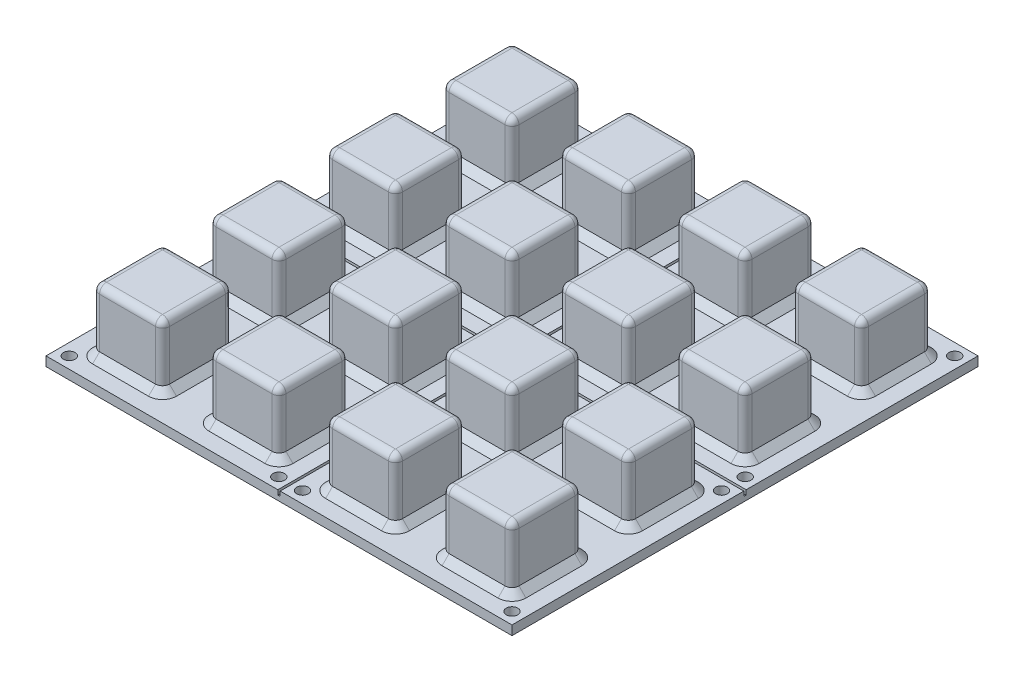
from build123d import *

# Parameters (mm, degrees)
BOSS_EXTRUDE1_DEPTH    = 15.7
BOSS_EXTRUDE1_2_DEPTH  = 15.7
BOSS_EXTRUDE1_3_DEPTH  = 15.7
BOSS_EXTRUDE1_4_DEPTH  = 15.7
BOSS_EXTRUDE1_5_DEPTH  = 15.7
BOSS_EXTRUDE1_6_DEPTH  = 15.7
BOSS_EXTRUDE1_7_DEPTH  = 15.7
BOSS_EXTRUDE1_8_DEPTH  = 15.7
BOSS_EXTRUDE1_9_DEPTH  = 15.7
BOSS_EXTRUDE1_10_DEPTH = 15.7
BOSS_EXTRUDE1_11_DEPTH = 15.7
BOSS_EXTRUDE1_12_DEPTH = 15.7
BOSS_EXTRUDE1_13_DEPTH = 15.7
BOSS_EXTRUDE1_14_DEPTH = 15.7
BOSS_EXTRUDE1_15_DEPTH = 15.7
BOSS_EXTRUDE1_16_DEPTH = 15.7
SKETCH4_W              = 100
SKETCH4_H              = 100
BOSS_EXTRUDE2_DEPTH    = 2
SKETCH5_W              = 0.5
SKETCH5_H              = 100
SKETCH5_W_2            = 100
SKETCH5_H_2            = 0.5
CUT_EXTRUDE1_DEPTH     = 1
SKETCH6_R              = 1.25
CUT_EXTRUDE3_DEPTH     = 3.54
CHAMFER4_SIZE          = 1.5
FILLET2_R              = 1.5
SKETCH7_R              = 4.25
CUT_EXTRUDE4_DEPTH     = 12
FILLET3_R              = 2.5
CUT_EXTRUDE6_DEPTH     = 2.5
SKETCH9_R              = 7
SKETCH9_R_2            = 5
BOSS_EXTRUDE3_DEPTH    = 1
BOSS_EXTRUDE3_2_DEPTH  = 1
BOSS_EXTRUDE3_3_DEPTH  = 1
BOSS_EXTRUDE3_4_DEPTH  = 1
BOSS_EXTRUDE3_5_DEPTH  = 1
BOSS_EXTRUDE3_6_DEPTH  = 1
BOSS_EXTRUDE3_7_DEPTH  = 1
BOSS_EXTRUDE3_8_DEPTH  = 1
BOSS_EXTRUDE3_9_DEPTH  = 1
BOSS_EXTRUDE3_10_DEPTH = 1
BOSS_EXTRUDE3_11_DEPTH = 1
BOSS_EXTRUDE3_12_DEPTH = 1
BOSS_EXTRUDE3_13_DEPTH = 1
BOSS_EXTRUDE3_14_DEPTH = 1
BOSS_EXTRUDE3_15_DEPTH = 1
BOSS_EXTRUDE3_16_DEPTH = 1
SKETCH10_R             = 7
SKETCH10_R_2           = 5
BOSS_EXTRUDE6_DEPTH    = 0.5
BOSS_EXTRUDE6_2_DEPTH  = 0.5
BOSS_EXTRUDE6_3_DEPTH  = 0.5
BOSS_EXTRUDE6_4_DEPTH  = 0.5
BOSS_EXTRUDE6_5_DEPTH  = 0.5
BOSS_EXTRUDE6_6_DEPTH  = 0.5
BOSS_EXTRUDE6_7_DEPTH  = 0.5
BOSS_EXTRUDE6_8_DEPTH  = 0.5
BOSS_EXTRUDE6_9_DEPTH  = 0.5
BOSS_EXTRUDE6_10_DEPTH = 0.5
BOSS_EXTRUDE6_11_DEPTH = 0.5
BOSS_EXTRUDE6_12_DEPTH = 0.5
BOSS_EXTRUDE6_13_DEPTH = 0.5
BOSS_EXTRUDE6_14_DEPTH = 0.5
BOSS_EXTRUDE6_15_DEPTH = 0.5
BOSS_EXTRUDE6_16_DEPTH = 0.5
SKETCH11_R             = 1.25
BOSS_EXTRUDE7_DEPTH    = 1.5
CHAMFER6_SIZE          = 0.25


with BuildPart() as part:
    # Sketch1 → Boss-Extrude1 (new body)
    with BuildSketch(Plane(origin=(0, 0, 0), x_dir=(1, 0, 0), z_dir=(0, 1, 0))):
        with BuildLine():
            Line((-18.5, -30), (-6.5, -30))
            ThreePointArc((-6.5, -30), (-5.439339828, -30.439339828), (-5, -31.5))
            Line((-5, -31.5), (-5, -43.5))
            ThreePointArc((-5, -43.5), (-5.439339828, -44.560660172), (-6.5, -45))
            Line((-6.5, -45), (-18.5, -45))
            ThreePointArc((-18.5, -45), (-19.560660172, -44.560660172), (-20, -43.5))
            Line((-20, -43.5), (-20, -31.5))
            ThreePointArc((-20, -31.5), (-19.560660172, -30.439339828), (-18.5, -30))
        make_face()
    extrude(amount=BOSS_EXTRUDE1_DEPTH)



with BuildPart() as body_2:
    # Sketch1 → Boss-Extrude1 2 (new body)
    with BuildSketch(Plane(origin=(0, 0, 0), x_dir=(1, 0, 0), z_dir=(0, 1, 0))):
        with BuildLine():
            Line((6.5, -30), (18.5, -30))
            ThreePointArc((18.5, -30), (19.560660172, -30.439339828), (20, -31.5))
            Line((20, -31.5), (20, -43.5))
            ThreePointArc((20, -43.5), (19.560660172, -44.560660172), (18.5, -45))
            Line((18.5, -45), (6.5, -45))
            ThreePointArc((6.5, -45), (5.439339828, -44.560660172), (5, -43.5))
            Line((5, -43.5), (5, -31.5))
            ThreePointArc((5, -31.5), (5.439339828, -30.439339828), (6.5, -30))
        make_face()
    extrude(amount=BOSS_EXTRUDE1_2_DEPTH)


with BuildPart() as body_3:
    # Sketch1 → Boss-Extrude1 3 (new body)
    with BuildSketch(Plane(origin=(0, 0, 0), x_dir=(1, 0, 0), z_dir=(0, 1, 0))):
        with BuildLine():
            Line((-43.5, -30), (-31.5, -30))
            ThreePointArc((-31.5, -30), (-30.439339828, -30.439339828), (-30, -31.5))
            Line((-30, -31.5), (-30, -43.5))
            ThreePointArc((-30, -43.5), (-30.439339828, -44.560660172), (-31.5, -45))
            Line((-31.5, -45), (-43.5, -45))
            ThreePointArc((-43.5, -45), (-44.560660172, -44.560660172), (-45, -43.5))
            Line((-45, -43.5), (-45, -31.5))
            ThreePointArc((-45, -31.5), (-44.560660172, -30.439339828), (-43.5, -30))
        make_face()
    extrude(amount=BOSS_EXTRUDE1_3_DEPTH)


with BuildPart() as body_4:
    # Sketch1 → Boss-Extrude1 4 (new body)
    with BuildSketch(Plane(origin=(0, 0, 0), x_dir=(1, 0, 0), z_dir=(0, 1, 0))):
        with BuildLine():
            Line((31.5, -30), (43.5, -30))
            ThreePointArc((43.5, -30), (44.560660172, -30.439339828), (45, -31.5))
            Line((45, -31.5), (45, -43.5))
            ThreePointArc((45, -43.5), (44.560660172, -44.560660172), (43.5, -45))
            Line((43.5, -45), (31.5, -45))
            ThreePointArc((31.5, -45), (30.439339828, -44.560660172), (30, -43.5))
            Line((30, -43.5), (30, -31.5))
            ThreePointArc((30, -31.5), (30.439339828, -30.439339828), (31.5, -30))
        make_face()
    extrude(amount=BOSS_EXTRUDE1_4_DEPTH)


with BuildPart() as body_5:
    # Sketch1 → Boss-Extrude1 5 (new body)
    with BuildSketch(Plane(origin=(0, 0, 0), x_dir=(1, 0, 0), z_dir=(0, 1, 0))):
        with BuildLine():
            Line((-18.5, -5), (-6.5, -5))
            ThreePointArc((-6.5, -5), (-5.439339828, -5.439339828), (-5, -6.5))
            Line((-5, -6.5), (-5, -18.5))
            ThreePointArc((-5, -18.5), (-5.439339828, -19.560660172), (-6.5, -20))
            Line((-6.5, -20), (-18.5, -20))
            ThreePointArc((-18.5, -20), (-19.560660172, -19.560660172), (-20, -18.5))
            Line((-20, -18.5), (-20, -6.5))
            ThreePointArc((-20, -6.5), (-19.560660172, -5.439339828), (-18.5, -5))
        make_face()
    extrude(amount=BOSS_EXTRUDE1_5_DEPTH)


with BuildPart() as body_6:
    # Sketch1 → Boss-Extrude1 6 (new body)
    with BuildSketch(Plane(origin=(0, 0, 0), x_dir=(1, 0, 0), z_dir=(0, 1, 0))):
        with BuildLine():
            Line((6.5, -5), (18.5, -5))
            ThreePointArc((18.5, -5), (19.560660172, -5.439339828), (20, -6.5))
            Line((20, -6.5), (20, -18.5))
            ThreePointArc((20, -18.5), (19.560660172, -19.560660172), (18.5, -20))
            Line((18.5, -20), (6.5, -20))
            ThreePointArc((6.5, -20), (5.439339828, -19.560660172), (5, -18.5))
            Line((5, -18.5), (5, -6.5))
            ThreePointArc((5, -6.5), (5.439339828, -5.439339828), (6.5, -5))
        make_face()
    extrude(amount=BOSS_EXTRUDE1_6_DEPTH)


with BuildPart() as body_7:
    # Sketch1 → Boss-Extrude1 7 (new body)
    with BuildSketch(Plane(origin=(0, 0, 0), x_dir=(1, 0, 0), z_dir=(0, 1, 0))):
        with BuildLine():
            Line((31.5, -5), (43.5, -5))
            ThreePointArc((43.5, -5), (44.560660172, -5.439339828), (45, -6.5))
            Line((45, -6.5), (45, -18.5))
            ThreePointArc((45, -18.5), (44.560660172, -19.560660172), (43.5, -20))
            Line((43.5, -20), (31.5, -20))
            ThreePointArc((31.5, -20), (30.439339828, -19.560660172), (30, -18.5))
            Line((30, -18.5), (30, -6.5))
            ThreePointArc((30, -6.5), (30.439339828, -5.439339828), (31.5, -5))
        make_face()
    extrude(amount=BOSS_EXTRUDE1_7_DEPTH)


with BuildPart() as body_8:
    # Sketch1 → Boss-Extrude1 8 (new body)
    with BuildSketch(Plane(origin=(0, 0, 0), x_dir=(1, 0, 0), z_dir=(0, 1, 0))):
        with BuildLine():
            Line((-18.5, 20), (-6.5, 20))
            ThreePointArc((-6.5, 20), (-5.439339828, 19.560660172), (-5, 18.5))
            Line((-5, 18.5), (-5, 6.5))
            ThreePointArc((-5, 6.5), (-5.439339828, 5.439339828), (-6.5, 5))
            Line((-6.5, 5), (-18.5, 5))
            ThreePointArc((-18.5, 5), (-19.560660172, 5.439339828), (-20, 6.5))
            Line((-20, 6.5), (-20, 18.5))
            ThreePointArc((-20, 18.5), (-19.560660172, 19.560660172), (-18.5, 20))
        make_face()
    extrude(amount=BOSS_EXTRUDE1_8_DEPTH)


with BuildPart() as body_9:
    # Sketch1 → Boss-Extrude1 9 (new body)
    with BuildSketch(Plane(origin=(0, 0, 0), x_dir=(1, 0, 0), z_dir=(0, 1, 0))):
        with BuildLine():
            Line((6.5, 20), (18.5, 20))
            ThreePointArc((18.5, 20), (19.560660172, 19.560660172), (20, 18.5))
            Line((20, 18.5), (20, 6.5))
            ThreePointArc((20, 6.5), (19.560660172, 5.439339828), (18.5, 5))
            Line((18.5, 5), (6.5, 5))
            ThreePointArc((6.5, 5), (5.439339828, 5.439339828), (5, 6.5))
            Line((5, 6.5), (5, 18.5))
            ThreePointArc((5, 18.5), (5.439339828, 19.560660172), (6.5, 20))
        make_face()
    extrude(amount=BOSS_EXTRUDE1_9_DEPTH)


with BuildPart() as body_10:
    # Sketch1 → Boss-Extrude1 10 (new body)
    with BuildSketch(Plane(origin=(0, 0, 0), x_dir=(1, 0, 0), z_dir=(0, 1, 0))):
        with BuildLine():
            Line((31.5, 20), (43.5, 20))
            ThreePointArc((43.5, 20), (44.560660172, 19.560660172), (45, 18.5))
            Line((45, 18.5), (45, 6.5))
            ThreePointArc((45, 6.5), (44.560660172, 5.439339828), (43.5, 5))
            Line((43.5, 5), (31.5, 5))
            ThreePointArc((31.5, 5), (30.439339828, 5.439339828), (30, 6.5))
            Line((30, 6.5), (30, 18.5))
            ThreePointArc((30, 18.5), (30.439339828, 19.560660172), (31.5, 20))
        make_face()
    extrude(amount=BOSS_EXTRUDE1_10_DEPTH)


with BuildPart() as body_11:
    # Sketch1 → Boss-Extrude1 11 (new body)
    with BuildSketch(Plane(origin=(0, 0, 0), x_dir=(1, 0, 0), z_dir=(0, 1, 0))):
        with BuildLine():
            Line((-18.5, 45), (-6.5, 45))
            ThreePointArc((-6.5, 45), (-5.439339828, 44.560660172), (-5, 43.5))
            Line((-5, 43.5), (-5, 31.5))
            ThreePointArc((-5, 31.5), (-5.439339828, 30.439339828), (-6.5, 30))
            Line((-6.5, 30), (-18.5, 30))
            ThreePointArc((-18.5, 30), (-19.560660172, 30.439339828), (-20, 31.5))
            Line((-20, 31.5), (-20, 43.5))
            ThreePointArc((-20, 43.5), (-19.560660172, 44.560660172), (-18.5, 45))
        make_face()
    extrude(amount=BOSS_EXTRUDE1_11_DEPTH)


with BuildPart() as body_12:
    # Sketch1 → Boss-Extrude1 12 (new body)
    with BuildSketch(Plane(origin=(0, 0, 0), x_dir=(1, 0, 0), z_dir=(0, 1, 0))):
        with BuildLine():
            Line((6.5, 45), (18.5, 45))
            ThreePointArc((18.5, 45), (19.560660172, 44.560660172), (20, 43.5))
            Line((20, 43.5), (20, 31.5))
            ThreePointArc((20, 31.5), (19.560660172, 30.439339828), (18.5, 30))
            Line((18.5, 30), (6.5, 30))
            ThreePointArc((6.5, 30), (5.439339828, 30.439339828), (5, 31.5))
            Line((5, 31.5), (5, 43.5))
            ThreePointArc((5, 43.5), (5.439339828, 44.560660172), (6.5, 45))
        make_face()
    extrude(amount=BOSS_EXTRUDE1_12_DEPTH)


with BuildPart() as body_13:
    # Sketch1 → Boss-Extrude1 13 (new body)
    with BuildSketch(Plane(origin=(0, 0, 0), x_dir=(1, 0, 0), z_dir=(0, 1, 0))):
        with BuildLine():
            Line((31.5, 45), (43.5, 45))
            ThreePointArc((43.5, 45), (44.560660172, 44.560660172), (45, 43.5))
            Line((45, 43.5), (45, 31.5))
            ThreePointArc((45, 31.5), (44.560660172, 30.439339828), (43.5, 30))
            Line((43.5, 30), (31.5, 30))
            ThreePointArc((31.5, 30), (30.439339828, 30.439339828), (30, 31.5))
            Line((30, 31.5), (30, 43.5))
            ThreePointArc((30, 43.5), (30.439339828, 44.560660172), (31.5, 45))
        make_face()
    extrude(amount=BOSS_EXTRUDE1_13_DEPTH)


with BuildPart() as body_14:
    # Sketch1 → Boss-Extrude1 14 (new body)
    with BuildSketch(Plane(origin=(0, 0, 0), x_dir=(1, 0, 0), z_dir=(0, 1, 0))):
        with BuildLine():
            Line((-43.5, -5), (-31.5, -5))
            ThreePointArc((-31.5, -5), (-30.439339828, -5.439339828), (-30, -6.5))
            Line((-30, -6.5), (-30, -18.5))
            ThreePointArc((-30, -18.5), (-30.439339828, -19.560660172), (-31.5, -20))
            Line((-31.5, -20), (-43.5, -20))
            ThreePointArc((-43.5, -20), (-44.560660172, -19.560660172), (-45, -18.5))
            Line((-45, -18.5), (-45, -6.5))
            ThreePointArc((-45, -6.5), (-44.560660172, -5.439339828), (-43.5, -5))
        make_face()
    extrude(amount=BOSS_EXTRUDE1_14_DEPTH)


with BuildPart() as body_15:
    # Sketch1 → Boss-Extrude1 15 (new body)
    with BuildSketch(Plane(origin=(0, 0, 0), x_dir=(1, 0, 0), z_dir=(0, 1, 0))):
        with BuildLine():
            Line((-43.5, 20), (-31.5, 20))
            ThreePointArc((-31.5, 20), (-30.439339828, 19.560660172), (-30, 18.5))
            Line((-30, 18.5), (-30, 6.5))
            ThreePointArc((-30, 6.5), (-30.439339828, 5.439339828), (-31.5, 5))
            Line((-31.5, 5), (-43.5, 5))
            ThreePointArc((-43.5, 5), (-44.560660172, 5.439339828), (-45, 6.5))
            Line((-45, 6.5), (-45, 18.5))
            ThreePointArc((-45, 18.5), (-44.560660172, 19.560660172), (-43.5, 20))
        make_face()
    extrude(amount=BOSS_EXTRUDE1_15_DEPTH)


with BuildPart() as body_16:
    # Sketch1 → Boss-Extrude1 16 (new body)
    with BuildSketch(Plane(origin=(0, 0, 0), x_dir=(1, 0, 0), z_dir=(0, 1, 0))):
        with BuildLine():
            Line((-43.5, 45), (-31.5, 45))
            ThreePointArc((-31.5, 45), (-30.439339828, 44.560660172), (-30, 43.5))
            Line((-30, 43.5), (-30, 31.5))
            ThreePointArc((-30, 31.5), (-30.439339828, 30.439339828), (-31.5, 30))
            Line((-31.5, 30), (-43.5, 30))
            ThreePointArc((-43.5, 30), (-44.560660172, 30.439339828), (-45, 31.5))
            Line((-45, 31.5), (-45, 43.5))
            ThreePointArc((-45, 43.5), (-44.560660172, 44.560660172), (-43.5, 45))
        make_face()
    extrude(amount=BOSS_EXTRUDE1_16_DEPTH)


with BuildPart() as part_1:
    add(part.part)

    add(body_2.part)  # Boss-Extrude2 merges body 2

    add(body_3.part)  # Boss-Extrude2 merges body 3

    add(body_4.part)  # Boss-Extrude2 merges body 4

    add(body_5.part)  # Boss-Extrude2 merges body 5

    add(body_6.part)  # Boss-Extrude2 merges body 6

    add(body_7.part)  # Boss-Extrude2 merges body 7

    add(body_8.part)  # Boss-Extrude2 merges body 8

    add(body_9.part)  # Boss-Extrude2 merges body 9

    add(body_10.part)  # Boss-Extrude2 merges body 10

    add(body_11.part)  # Boss-Extrude2 merges body 11

    add(body_12.part)  # Boss-Extrude2 merges body 12

    add(body_13.part)  # Boss-Extrude2 merges body 13

    add(body_14.part)  # Boss-Extrude2 merges body 14

    add(body_15.part)  # Boss-Extrude2 merges body 15

    add(body_16.part)  # Boss-Extrude2 merges body 16
    # Sketch4 → Boss-Extrude2 (add)
    with BuildSketch(Plane(origin=(0, 0, 0), x_dir=(1, 0, 0), z_dir=(0, 1, 0))):
        Rectangle(SKETCH4_W, SKETCH4_H)
    extrude(amount=BOSS_EXTRUDE2_DEPTH)

    # Sketch5 → Cut-Extrude1 (cut)
    with BuildSketch(Plane(origin=(0, 2, 0), x_dir=(1, 0, 0), z_dir=(0, 1, 0))):
        Rectangle(SKETCH5_W, SKETCH5_H)
        Rectangle(SKETCH5_W_2, SKETCH5_H_2)
    extrude(amount=-CUT_EXTRUDE1_DEPTH, mode=Mode.SUBTRACT)

    # Sketch6 → Cut-Extrude3 (cut)
    with BuildSketch(Plane(origin=(0, 0, 0), x_dir=(1, 0, 0), z_dir=(0, 1, 0))):
        with Locations(Location((-47.5, 47.5, 0), (0, 0, 270))):
            Circle(SKETCH6_R)
        with Locations(Location((-2.542, 47.5, 0), (0, 0, 270))):
            Circle(SKETCH6_R)
        with Locations(Location((-2.542, 2.542, 0), (0, 0, 270))):
            Circle(SKETCH6_R)
        with Locations(Location((-47.5, 2.542, 0), (0, 0, 270))):
            Circle(SKETCH6_R)
        with Locations(Location((47.5, 2.542, 0), (0, 0, 90))):
            Circle(SKETCH6_R)
        with Locations(Location((2.542, 2.542, 0), (0, 0, 90))):
            Circle(SKETCH6_R)
        with Locations(Location((2.542, 47.5, 0), (0, 0, 90))):
            Circle(SKETCH6_R)
        with Locations(Location((47.5, 47.5, 0), (0, 0, 90))):
            Circle(SKETCH6_R)
        with Locations(Location((47.5, -47.5, 0), (0, 0, 270))):
            Circle(SKETCH6_R)
        with Locations(Location((2.542, -47.5, 0), (0, 0, 270))):
            Circle(SKETCH6_R)
        with Locations(Location((2.542, -2.542, 0), (0, 0, 270))):
            Circle(SKETCH6_R)
        with Locations(Location((47.5, -2.542, 0), (0, 0, 270))):
            Circle(SKETCH6_R)
        with Locations(Location((-47.5, -2.542, 0), (0, 0, 90))):
            Circle(SKETCH6_R)
        with Locations(Location((-2.542, -2.542, 0), (0, 0, 90))):
            Circle(SKETCH6_R)
        with Locations(Location((-2.542, -47.5, 0), (0, 0, 90))):
            Circle(SKETCH6_R)
        with Locations(Location((-47.5, -47.5, 0), (0, 0, 90))):
            Circle(SKETCH6_R)
    extrude(amount=CUT_EXTRUDE3_DEPTH, mode=Mode.SUBTRACT)

    # Chamfer4
    chamfer4_edges = [part_1.edges().sort_by_distance(p)[0] for p in [
        (44.560660172, 2, 30.439339828),
        (37.5, 2, 30),
        (30.439339828, 2, 30.439339828),
        (30, 2, 37.5),
        (30.439339828, 2, 44.560660172),
        (37.5, 2, 45),
        (44.560660172, 2, 44.560660172),
        (45, 2, 37.5),
        (-5.439339828, 2, 5.439339828),
        (-12.5, 2, 5),
        (-19.560660172, 2, 5.439339828),
        (-20, 2, 12.5),
        (-19.560660172, 2, 19.560660172),
        (-12.5, 2, 20),
        (-5.439339828, 2, 19.560660172),
        (-5, 2, 12.5),
        (19.560660172, 2, 5.439339828),
        (12.5, 2, 5),
        (5.439339828, 2, 5.439339828),
        (5, 2, 12.5),
        (5.439339828, 2, 19.560660172),
        (12.5, 2, 20),
        (19.560660172, 2, 19.560660172),
        (20, 2, 12.5),
        (44.560660172, 2, 5.439339828),
        (37.5, 2, 5),
        (30.439339828, 2, 5.439339828),
        (30, 2, 12.5),
        (30.439339828, 2, 19.560660172),
        (37.5, 2, 20),
        (44.560660172, 2, 19.560660172),
        (45, 2, 12.5),
        (-5.439339828, 2, -19.560660172),
        (-12.5, 2, -20),
        (-19.560660172, 2, -19.560660172),
        (-20, 2, -12.5),
        (-19.560660172, 2, -5.439339828),
        (-12.5, 2, -5),
        (-5.439339828, 2, -5.439339828),
        (-5, 2, -12.5),
        (19.560660172, 2, -19.560660172),
        (12.5, 2, -20),
        (5.439339828, 2, -19.560660172),
        (-30, 2, 37.5),
        (5, 2, -12.5),
        (5.439339828, 2, -5.439339828),
        (12.5, 2, -5),
        (19.560660172, 2, -5.439339828),
        (20, 2, -12.5),
        (44.560660172, 2, -19.560660172),
        (37.5, 2, -20),
        (30.439339828, 2, -19.560660172),
        (30, 2, -12.5),
        (30.439339828, 2, -5.439339828),
        (37.5, 2, -5),
        (44.560660172, 2, -5.439339828),
        (45, 2, -12.5),
        (-5.439339828, 2, -44.560660172),
        (-12.5, 2, -45),
        (-19.560660172, 2, -44.560660172),
        (-20, 2, -37.5),
        (-19.560660172, 2, -30.439339828),
        (-12.5, 2, -30),
        (-5.439339828, 2, -30.439339828),
        (-5, 2, -37.5),
        (19.560660172, 2, -44.560660172),
        (12.5, 2, -45),
        (5.439339828, 2, -44.560660172),
        (5, 2, -37.5),
        (5.439339828, 2, -30.439339828),
        (12.5, 2, -30),
        (19.560660172, 2, -30.439339828),
        (20, 2, -37.5),
        (-30.439339828, 2, 30.439339828),
        (-37.5, 2, 30),
        (-44.560660172, 2, 30.439339828),
        (-45, 2, 37.5),
        (-44.560660172, 2, 44.560660172),
        (-37.5, 2, 45),
        (-30.439339828, 2, 44.560660172),
        (44.560660172, 2, -44.560660172),
        (37.5, 2, -45),
        (30.439339828, 2, -44.560660172),
        (30, 2, -37.5),
        (30.439339828, 2, -30.439339828),
        (37.5, 2, -30),
        (44.560660172, 2, -30.439339828),
        (45, 2, -37.5),
        (-30.439339828, 2, 5.439339828),
        (-37.5, 2, 5),
        (-44.560660172, 2, 5.439339828),
        (-45, 2, 12.5),
        (-44.560660172, 2, 19.560660172),
        (-37.5, 2, 20),
        (-30.439339828, 2, 19.560660172),
        (-30, 2, 12.5),
        (-30.439339828, 2, -19.560660172),
        (-37.5, 2, -20),
        (-44.560660172, 2, -19.560660172),
        (-45, 2, -12.5),
        (-44.560660172, 2, -5.439339828),
        (-37.5, 2, -5),
        (-30.439339828, 2, -5.439339828),
        (-30, 2, -12.5),
        (-30.439339828, 2, -44.560660172),
        (-37.5, 2, -45),
        (-44.560660172, 2, -44.560660172),
        (-45, 2, -37.5),
        (-44.560660172, 2, -30.439339828),
        (-37.5, 2, -30),
        (-30.439339828, 2, -30.439339828),
        (-30, 2, -37.5),
        (-5.439339828, 2, 30.439339828),
        (-12.5, 2, 30),
        (-19.560660172, 2, 30.439339828),
        (-20, 2, 37.5),
        (-19.560660172, 2, 44.560660172),
        (-12.5, 2, 45),
        (-5.439339828, 2, 44.560660172),
        (-5, 2, 37.5),
        (19.560660172, 2, 30.439339828),
        (12.5, 2, 30),
        (5.439339828, 2, 30.439339828),
        (5, 2, 37.5),
        (5.439339828, 2, 44.560660172),
        (12.5, 2, 45),
        (19.560660172, 2, 44.560660172),
        (20, 2, 37.5),
    ]]
    chamfer(chamfer4_edges, length=CHAMFER4_SIZE)

    # Fillet2
    fillet2_edges = [part_1.edges().sort_by_distance(p)[0] for p in [
        (37.5, 15.7, 30),
        (30, 15.7, 37.5),
        (37.5, 15.7, 45),
        (45, 15.7, 37.5),
        (-45, 15.7, 37.5),
        (-12.5, 15.7, 5),
        (-20, 15.7, 12.5),
        (-12.5, 15.7, 20),
        (-5, 15.7, 12.5),
        (12.5, 15.7, 5),
        (5, 15.7, 12.5),
        (12.5, 15.7, 20),
        (20, 15.7, 12.5),
        (37.5, 15.7, 5),
        (30, 15.7, 12.5),
        (37.5, 15.7, 20),
        (45, 15.7, 12.5),
        (-37.5, 15.7, 45),
        (-12.5, 15.7, -20),
        (-20, 15.7, -12.5),
        (-12.5, 15.7, -5),
        (-5, 15.7, -12.5),
        (12.5, 15.7, -20),
        (5, 15.7, -12.5),
        (12.5, 15.7, -5),
        (20, 15.7, -12.5),
        (-30, 15.7, 37.5),
        (37.5, 15.7, -20),
        (30, 15.7, -12.5),
        (37.5, 15.7, -5),
        (45, 15.7, -12.5),
        (-12.5, 15.7, -45),
        (-20, 15.7, -37.5),
        (-12.5, 15.7, -30),
        (-5, 15.7, -37.5),
        (12.5, 15.7, -45),
        (5, 15.7, -37.5),
        (12.5, 15.7, -30),
        (20, 15.7, -37.5),
        (37.5, 15.7, -45),
        (30, 15.7, -37.5),
        (37.5, 15.7, -30),
        (45, 15.7, -37.5),
        (-37.5, 15.7, 5),
        (-45, 15.7, 12.5),
        (-37.5, 15.7, 20),
        (-30, 15.7, 12.5),
        (-37.5, 15.7, -20),
        (-45, 15.7, -12.5),
        (-37.5, 15.7, -5),
        (-30, 15.7, -12.5),
        (-37.5, 15.7, -45),
        (-45, 15.7, -37.5),
        (-37.5, 15.7, -30),
        (-30, 15.7, -37.5),
        (-12.5, 15.7, 30),
        (-20, 15.7, 37.5),
        (-12.5, 15.7, 45),
        (-5, 15.7, 37.5),
        (-37.5, 15.7, 30),
        (12.5, 15.7, 30),
        (5, 15.7, 37.5),
        (12.5, 15.7, 45),
        (20, 15.7, 37.5),
    ]]
    fillet(fillet2_edges, radius=FILLET2_R)

    # Sketch7 → Cut-Extrude4 (cut)
    with BuildSketch(Plane.XZ):
        with Locations(Location((-37.5, 37.5, 0), (0, 0, 270))):
            Circle(SKETCH7_R)
        with Locations(Location((-12.5, 37.5, 0), (0, 0, 270))):
            Circle(SKETCH7_R)
        with Locations(Location((12.5, 37.5, 0), (0, 0, 270))):
            Circle(SKETCH7_R)
        with Locations(Location((37.5, 37.5, 0), (0, 0, 270))):
            Circle(SKETCH7_R)
        with Locations(Location((-12.5, 12.5, 0), (0, 0, 270))):
            Circle(SKETCH7_R)
        with Locations(Location((12.5, 12.5, 0), (0, 0, 270))):
            Circle(SKETCH7_R)
        with Locations(Location((37.5, 12.5, 0), (0, 0, 270))):
            Circle(SKETCH7_R)
        with Locations(Location((-12.5, -12.5, 0), (0, 0, 270))):
            Circle(SKETCH7_R)
        with Locations(Location((12.5, -12.5, 0), (0, 0, 270))):
            Circle(SKETCH7_R)
        with Locations(Location((37.5, -12.5, 0), (0, 0, 270))):
            Circle(SKETCH7_R)
        with Locations(Location((-12.5, -37.5, 0), (0, 0, 270))):
            Circle(SKETCH7_R)
        with Locations(Location((12.5, -37.5, 0), (0, 0, 270))):
            Circle(SKETCH7_R)
        with Locations(Location((37.5, -37.5, 0), (0, 0, 270))):
            Circle(SKETCH7_R)
        with Locations(Location((-37.5, 12.5, 0), (0, 0, 270))):
            Circle(SKETCH7_R)
        with Locations(Location((-37.5, -12.5, 0), (0, 0, 270))):
            Circle(SKETCH7_R)
        with Locations(Location((-37.5, -37.5, 0), (0, 0, 270))):
            Circle(SKETCH7_R)
    extrude(amount=-CUT_EXTRUDE4_DEPTH, mode=Mode.SUBTRACT)

    # Fillet3
    fillet3_edges = [part_1.edges().sort_by_distance(p)[0] for p in [
        (-37.5, 12, 41.75),
        (-12.5, 12, 41.75),
        (12.5, 12, 41.75),
        (37.5, 12, 41.75),
        (-12.5, 12, 16.75),
        (12.5, 12, 16.75),
        (37.5, 12, 16.75),
        (-12.5, 12, -8.25),
        (12.5, 12, -8.25),
        (37.5, 12, -8.25),
        (-12.5, 12, -33.25),
        (12.5, 12, -33.25),
        (37.5, 12, -33.25),
        (-37.5, 12, 16.75),
        (-37.5, 12, -8.25),
        (-37.5, 12, -33.25),
    ]]
    fillet(fillet3_edges, radius=FILLET3_R)

    # Sketch8 → Cut-Extrude6 (cut)
    with BuildSketch(Plane.XZ):
        with BuildLine():
            Line((-18.429516067, 29.5), (-6.570483933, 29.5))
            ThreePointArc((-6.570483933, 29.5), (-5.106430704, 30.106430704), (-4.5, 31.570483933))
            Line((-4.5, 31.570483933), (-4.5, 43.429516067))
            ThreePointArc((-4.5, 43.429516067), (-5.106430704, 44.893569296), (-6.570483933, 45.5))
            Line((-6.570483933, 45.5), (-18.429516067, 45.5))
            ThreePointArc((-18.429516067, 45.5), (-19.893569296, 44.893569296), (-20.5, 43.429516067))
            Line((-20.5, 43.429516067), (-20.5, 31.570483933))
            ThreePointArc((-20.5, 31.570483933), (-19.893569296, 30.106430704), (-18.429516067, 29.5))
        make_face()
        with BuildLine():
            Line((-43.429516067, 29.5), (-31.570483933, 29.5))
            ThreePointArc((-31.570483933, 29.5), (-30.106430704, 30.106430704), (-29.5, 31.570483933))
            Line((-29.5, 31.570483933), (-29.5, 43.429516067))
            ThreePointArc((-29.5, 43.429516067), (-30.106430704, 44.893569296), (-31.570483933, 45.5))
            Line((-31.570483933, 45.5), (-43.429516067, 45.5))
            ThreePointArc((-43.429516067, 45.5), (-44.893569296, 44.893569296), (-45.5, 43.429516067))
            Line((-45.5, 43.429516067), (-45.5, 31.570483933))
            ThreePointArc((-45.5, 31.570483933), (-44.893569296, 30.106430704), (-43.429516067, 29.5))
        make_face()
        with BuildLine():
            Line((6.570483933, 29.5), (18.429516067, 29.5))
            ThreePointArc((18.429516067, 29.5), (19.893569296, 30.106430704), (20.5, 31.570483933))
            Line((20.5, 31.570483933), (20.5, 43.429516067))
            ThreePointArc((20.5, 43.429516067), (19.893569296, 44.893569296), (18.429516067, 45.5))
            Line((18.429516067, 45.5), (6.570483933, 45.5))
            ThreePointArc((6.570483933, 45.5), (5.106430704, 44.893569296), (4.5, 43.429516067))
            Line((4.5, 43.429516067), (4.5, 31.570483933))
            ThreePointArc((4.5, 31.570483933), (5.106430704, 30.106430704), (6.570483933, 29.5))
        make_face()
        with BuildLine():
            Line((31.570483933, 29.5), (43.429516067, 29.5))
            ThreePointArc((43.429516067, 29.5), (44.893569296, 30.106430704), (45.5, 31.570483933))
            Line((45.5, 31.570483933), (45.5, 43.429516067))
            ThreePointArc((45.5, 43.429516067), (44.893569296, 44.893569296), (43.429516067, 45.5))
            Line((43.429516067, 45.5), (31.570483933, 45.5))
            ThreePointArc((31.570483933, 45.5), (30.106430704, 44.893569296), (29.5, 43.429516067))
            Line((29.5, 43.429516067), (29.5, 31.570483933))
            ThreePointArc((29.5, 31.570483933), (30.106430704, 30.106430704), (31.570483933, 29.5))
        make_face()
        with BuildLine():
            Line((-18.429516067, 4.5), (-6.570483933, 4.5))
            ThreePointArc((-6.570483933, 4.5), (-5.106430704, 5.106430704), (-4.5, 6.570483933))
            Line((-4.5, 6.570483933), (-4.5, 18.429516067))
            ThreePointArc((-4.5, 18.429516067), (-5.106430704, 19.893569296), (-6.570483933, 20.5))
            Line((-6.570483933, 20.5), (-18.429516067, 20.5))
            ThreePointArc((-18.429516067, 20.5), (-19.893569296, 19.893569296), (-20.5, 18.429516067))
            Line((-20.5, 18.429516067), (-20.5, 6.570483933))
            ThreePointArc((-20.5, 6.570483933), (-19.893569296, 5.106430704), (-18.429516067, 4.5))
        make_face()
        with BuildLine():
            Line((6.570483933, 4.5), (18.429516067, 4.5))
            ThreePointArc((18.429516067, 4.5), (19.893569296, 5.106430704), (20.5, 6.570483933))
            Line((20.5, 6.570483933), (20.5, 18.429516067))
            ThreePointArc((20.5, 18.429516067), (19.893569296, 19.893569296), (18.429516067, 20.5))
            Line((18.429516067, 20.5), (6.570483933, 20.5))
            ThreePointArc((6.570483933, 20.5), (5.106430704, 19.893569296), (4.5, 18.429516067))
            Line((4.5, 18.429516067), (4.5, 6.570483933))
            ThreePointArc((4.5, 6.570483933), (5.106430704, 5.106430704), (6.570483933, 4.5))
        make_face()
        with BuildLine():
            Line((31.570483933, 4.5), (43.429516067, 4.5))
            ThreePointArc((43.429516067, 4.5), (44.893569296, 5.106430704), (45.5, 6.570483933))
            Line((45.5, 6.570483933), (45.5, 18.429516067))
            ThreePointArc((45.5, 18.429516067), (44.893569296, 19.893569296), (43.429516067, 20.5))
            Line((43.429516067, 20.5), (31.570483933, 20.5))
            ThreePointArc((31.570483933, 20.5), (30.106430704, 19.893569296), (29.5, 18.429516067))
            Line((29.5, 18.429516067), (29.5, 6.570483933))
            ThreePointArc((29.5, 6.570483933), (30.106430704, 5.106430704), (31.570483933, 4.5))
        make_face()
        with BuildLine():
            Line((-18.429516067, -20.5), (-6.570483933, -20.5))
            ThreePointArc((-6.570483933, -20.5), (-5.106430704, -19.893569296), (-4.5, -18.429516067))
            Line((-4.5, -18.429516067), (-4.5, -6.570483933))
            ThreePointArc((-4.5, -6.570483933), (-5.106430704, -5.106430704), (-6.570483933, -4.5))
            Line((-6.570483933, -4.5), (-18.429516067, -4.5))
            ThreePointArc((-18.429516067, -4.5), (-19.893569296, -5.106430704), (-20.5, -6.570483933))
            Line((-20.5, -6.570483933), (-20.5, -18.429516067))
            ThreePointArc((-20.5, -18.429516067), (-19.893569296, -19.893569296), (-18.429516067, -20.5))
        make_face()
        with BuildLine():
            Line((6.570483933, -20.5), (18.429516067, -20.5))
            ThreePointArc((18.429516067, -20.5), (19.893569296, -19.893569296), (20.5, -18.429516067))
            Line((20.5, -18.429516067), (20.5, -6.570483933))
            ThreePointArc((20.5, -6.570483933), (19.893569296, -5.106430704), (18.429516067, -4.5))
            Line((18.429516067, -4.5), (6.570483933, -4.5))
            ThreePointArc((6.570483933, -4.5), (5.106430704, -5.106430704), (4.5, -6.570483933))
            Line((4.5, -6.570483933), (4.5, -18.429516067))
            ThreePointArc((4.5, -18.429516067), (5.106430704, -19.893569296), (6.570483933, -20.5))
        make_face()
        with BuildLine():
            Line((31.570483933, -20.5), (43.429516067, -20.5))
            ThreePointArc((43.429516067, -20.5), (44.893569296, -19.893569296), (45.5, -18.429516067))
            Line((45.5, -18.429516067), (45.5, -6.570483933))
            ThreePointArc((45.5, -6.570483933), (44.893569296, -5.106430704), (43.429516067, -4.5))
            Line((43.429516067, -4.5), (31.570483933, -4.5))
            ThreePointArc((31.570483933, -4.5), (30.106430704, -5.106430704), (29.5, -6.570483933))
            Line((29.5, -6.570483933), (29.5, -18.429516067))
            ThreePointArc((29.5, -18.429516067), (30.106430704, -19.893569296), (31.570483933, -20.5))
        make_face()
        with BuildLine():
            Line((-18.429516067, -45.5), (-6.570483933, -45.5))
            ThreePointArc((-6.570483933, -45.5), (-5.106430704, -44.893569296), (-4.5, -43.429516067))
            Line((-4.5, -43.429516067), (-4.5, -31.570483933))
            ThreePointArc((-4.5, -31.570483933), (-5.106430704, -30.106430704), (-6.570483933, -29.5))
            Line((-6.570483933, -29.5), (-18.429516067, -29.5))
            ThreePointArc((-18.429516067, -29.5), (-19.893569296, -30.106430704), (-20.5, -31.570483933))
            Line((-20.5, -31.570483933), (-20.5, -43.429516067))
            ThreePointArc((-20.5, -43.429516067), (-19.893569296, -44.893569296), (-18.429516067, -45.5))
        make_face()
        with BuildLine():
            Line((6.570483933, -45.5), (18.429516067, -45.5))
            ThreePointArc((18.429516067, -45.5), (19.893569296, -44.893569296), (20.5, -43.429516067))
            Line((20.5, -43.429516067), (20.5, -31.570483933))
            ThreePointArc((20.5, -31.570483933), (19.893569296, -30.106430704), (18.429516067, -29.5))
            Line((18.429516067, -29.5), (6.570483933, -29.5))
            ThreePointArc((6.570483933, -29.5), (5.106430704, -30.106430704), (4.5, -31.570483933))
            Line((4.5, -31.570483933), (4.5, -43.429516067))
            ThreePointArc((4.5, -43.429516067), (5.106430704, -44.893569296), (6.570483933, -45.5))
        make_face()
        with BuildLine():
            Line((31.570483933, -45.5), (43.429516067, -45.5))
            ThreePointArc((43.429516067, -45.5), (44.893569296, -44.893569296), (45.5, -43.429516067))
            Line((45.5, -43.429516067), (45.5, -31.570483933))
            ThreePointArc((45.5, -31.570483933), (44.893569296, -30.106430704), (43.429516067, -29.5))
            Line((43.429516067, -29.5), (31.570483933, -29.5))
            ThreePointArc((31.570483933, -29.5), (30.106430704, -30.106430704), (29.5, -31.570483933))
            Line((29.5, -31.570483933), (29.5, -43.429516067))
            ThreePointArc((29.5, -43.429516067), (30.106430704, -44.893569296), (31.570483933, -45.5))
        make_face()
        with BuildLine():
            Line((-43.429516067, 4.5), (-31.570483933, 4.5))
            ThreePointArc((-31.570483933, 4.5), (-30.106430704, 5.106430704), (-29.5, 6.570483933))
            Line((-29.5, 6.570483933), (-29.5, 18.429516067))
            ThreePointArc((-29.5, 18.429516067), (-30.106430704, 19.893569296), (-31.570483933, 20.5))
            Line((-31.570483933, 20.5), (-43.429516067, 20.5))
            ThreePointArc((-43.429516067, 20.5), (-44.893569296, 19.893569296), (-45.5, 18.429516067))
            Line((-45.5, 18.429516067), (-45.5, 6.570483933))
            ThreePointArc((-45.5, 6.570483933), (-44.893569296, 5.106430704), (-43.429516067, 4.5))
        make_face()
        with BuildLine():
            Line((-43.429516067, -20.5), (-31.570483933, -20.5))
            ThreePointArc((-31.570483933, -20.5), (-30.106430704, -19.893569296), (-29.5, -18.429516067))
            Line((-29.5, -18.429516067), (-29.5, -6.570483933))
            ThreePointArc((-29.5, -6.570483933), (-30.106430704, -5.106430704), (-31.570483933, -4.5))
            Line((-31.570483933, -4.5), (-43.429516067, -4.5))
            ThreePointArc((-43.429516067, -4.5), (-44.893569296, -5.106430704), (-45.5, -6.570483933))
            Line((-45.5, -6.570483933), (-45.5, -18.429516067))
            ThreePointArc((-45.5, -18.429516067), (-44.893569296, -19.893569296), (-43.429516067, -20.5))
        make_face()
        with BuildLine():
            Line((-43.429516067, -45.5), (-31.570483933, -45.5))
            ThreePointArc((-31.570483933, -45.5), (-30.106430704, -44.893569296), (-29.5, -43.429516067))
            Line((-29.5, -43.429516067), (-29.5, -31.570483933))
            ThreePointArc((-29.5, -31.570483933), (-30.106430704, -30.106430704), (-31.570483933, -29.5))
            Line((-31.570483933, -29.5), (-43.429516067, -29.5))
            ThreePointArc((-43.429516067, -29.5), (-44.893569296, -30.106430704), (-45.5, -31.570483933))
            Line((-45.5, -31.570483933), (-45.5, -43.429516067))
            ThreePointArc((-45.5, -43.429516067), (-44.893569296, -44.893569296), (-43.429516067, -45.5))
        make_face()
    extrude(amount=-CUT_EXTRUDE6_DEPTH, mode=Mode.SUBTRACT)

    # Sketch11 → Boss-Extrude7 (add)
    with BuildSketch(Plane.XZ):
        with Locations(Location((-25, 37.5, 0), (0, 0, 270))):
            Circle(SKETCH11_R)
        with Locations(Location((-37.5, 25, 0), (0, 0, 270))):
            Circle(SKETCH11_R)
        with Locations(Location((-12.5, 25, 0), (0, 0, 270))):
            Circle(SKETCH11_R)
        with Locations(Location((-25, 12.5, 0), (0, 0, 270))):
            Circle(SKETCH11_R)
        with Locations(Location((25, 12.5, 0), (0, 0, 90))):
            Circle(SKETCH11_R)
        with Locations(Location((12.5, 25, 0), (0, 0, 90))):
            Circle(SKETCH11_R)
        with Locations(Location((37.5, 25, 0), (0, 0, 90))):
            Circle(SKETCH11_R)
        with Locations(Location((25, 37.5, 0), (0, 0, 90))):
            Circle(SKETCH11_R)
        with Locations(Location((25, -37.5, 0), (0, 0, 270))):
            Circle(SKETCH11_R)
        with Locations(Location((37.5, -25, 0), (0, 0, 270))):
            Circle(SKETCH11_R)
        with Locations(Location((12.5, -25, 0), (0, 0, 270))):
            Circle(SKETCH11_R)
        with Locations(Location((25, -12.5, 0), (0, 0, 270))):
            Circle(SKETCH11_R)
        with Locations(Location((-25, -12.5, 0), (0, 0, 90))):
            Circle(SKETCH11_R)
        with Locations(Location((-12.5, -25, 0), (0, 0, 90))):
            Circle(SKETCH11_R)
        with Locations(Location((-37.5, -25, 0), (0, 0, 90))):
            Circle(SKETCH11_R)
        with Locations(Location((-25, -37.5, 0), (0, 0, 90))):
            Circle(SKETCH11_R)
    extrude(amount=BOSS_EXTRUDE7_DEPTH)

    # Chamfer6
    chamfer6_edges = [part_1.edges().sort_by_distance(p)[0] for p in [
        (-25, -1.5, 38.75),
        (-37.5, -1.5, 26.25),
        (-12.5, -1.5, 26.25),
        (-25, -1.5, 13.75),
        (25, -1.5, 11.25),
        (12.5, -1.5, 23.75),
        (37.5, -1.5, 23.75),
        (25, -1.5, 36.25),
        (25, -1.5, -36.25),
        (37.5, -1.5, -23.75),
        (12.5, -1.5, -23.75),
        (25, -1.5, -11.25),
        (-25, -1.5, -13.75),
        (-12.5, -1.5, -26.25),
        (-37.5, -1.5, -26.25),
        (-25, -1.5, -38.75),
    ]]
    chamfer(chamfer6_edges, length=CHAMFER6_SIZE)


with BuildPart() as body_2_2:
    # Sketch9 → Boss-Extrude3 (new body)
    with BuildSketch(Plane.XZ.offset(-2.5)):
        with Locations(Location((-37.5, 37.5, 0), (0, 0, 270))):
            Circle(SKETCH9_R)
        with Locations(Location((-37.5, 37.5, 0), (0, 0, 270))):
            Circle(SKETCH9_R_2, mode=Mode.SUBTRACT)
    extrude(amount=BOSS_EXTRUDE3_DEPTH)


with BuildPart() as body_3_2:
    # Sketch9 → Boss-Extrude3 2 (new body)
    with BuildSketch(Plane.XZ.offset(-2.5)):
        with Locations(Location((-12.5, 37.5, 0), (0, 0, 270))):
            Circle(SKETCH9_R)
        with Locations(Location((-12.5, 37.5, 0), (0, 0, 270))):
            Circle(SKETCH9_R_2, mode=Mode.SUBTRACT)
    extrude(amount=BOSS_EXTRUDE3_2_DEPTH)


with BuildPart() as body_4_2:
    # Sketch9 → Boss-Extrude3 3 (new body)
    with BuildSketch(Plane.XZ.offset(-2.5)):
        with Locations(Location((12.5, 37.5, 0), (0, 0, 270))):
            Circle(SKETCH9_R)
        with Locations(Location((12.5, 37.5, 0), (0, 0, 270))):
            Circle(SKETCH9_R_2, mode=Mode.SUBTRACT)
    extrude(amount=BOSS_EXTRUDE3_3_DEPTH)


with BuildPart() as body_5_2:
    # Sketch9 → Boss-Extrude3 4 (new body)
    with BuildSketch(Plane.XZ.offset(-2.5)):
        with Locations(Location((37.5, 37.5, 0), (0, 0, 270))):
            Circle(SKETCH9_R)
        with Locations(Location((37.5, 37.5, 0), (0, 0, 270))):
            Circle(SKETCH9_R_2, mode=Mode.SUBTRACT)
    extrude(amount=BOSS_EXTRUDE3_4_DEPTH)


with BuildPart() as body_6_2:
    # Sketch9 → Boss-Extrude3 5 (new body)
    with BuildSketch(Plane.XZ.offset(-2.5)):
        with Locations(Location((-12.5, 12.5, 0), (0, 0, 270))):
            Circle(SKETCH9_R)
        with Locations(Location((-12.5, 12.5, 0), (0, 0, 270))):
            Circle(SKETCH9_R_2, mode=Mode.SUBTRACT)
    extrude(amount=BOSS_EXTRUDE3_5_DEPTH)


with BuildPart() as body_7_2:
    # Sketch9 → Boss-Extrude3 6 (new body)
    with BuildSketch(Plane.XZ.offset(-2.5)):
        with Locations(Location((12.5, 12.5, 0), (0, 0, 270))):
            Circle(SKETCH9_R)
        with Locations(Location((12.5, 12.5, 0), (0, 0, 270))):
            Circle(SKETCH9_R_2, mode=Mode.SUBTRACT)
    extrude(amount=BOSS_EXTRUDE3_6_DEPTH)


with BuildPart() as body_8_2:
    # Sketch9 → Boss-Extrude3 7 (new body)
    with BuildSketch(Plane.XZ.offset(-2.5)):
        with Locations(Location((37.5, 12.5, 0), (0, 0, 270))):
            Circle(SKETCH9_R)
        with Locations(Location((37.5, 12.5, 0), (0, 0, 270))):
            Circle(SKETCH9_R_2, mode=Mode.SUBTRACT)
    extrude(amount=BOSS_EXTRUDE3_7_DEPTH)


with BuildPart() as body_9_2:
    # Sketch9 → Boss-Extrude3 8 (new body)
    with BuildSketch(Plane.XZ.offset(-2.5)):
        with Locations(Location((-12.5, -12.5, 0), (0, 0, 270))):
            Circle(SKETCH9_R)
        with Locations(Location((-12.5, -12.5, 0), (0, 0, 270))):
            Circle(SKETCH9_R_2, mode=Mode.SUBTRACT)
    extrude(amount=BOSS_EXTRUDE3_8_DEPTH)


with BuildPart() as body_10_2:
    # Sketch9 → Boss-Extrude3 9 (new body)
    with BuildSketch(Plane.XZ.offset(-2.5)):
        with Locations(Location((12.5, -12.5, 0), (0, 0, 270))):
            Circle(SKETCH9_R)
        with Locations(Location((12.5, -12.5, 0), (0, 0, 270))):
            Circle(SKETCH9_R_2, mode=Mode.SUBTRACT)
    extrude(amount=BOSS_EXTRUDE3_9_DEPTH)


with BuildPart() as body_11_2:
    # Sketch9 → Boss-Extrude3 10 (new body)
    with BuildSketch(Plane.XZ.offset(-2.5)):
        with Locations(Location((37.5, -12.5, 0), (0, 0, 270))):
            Circle(SKETCH9_R)
        with Locations(Location((37.5, -12.5, 0), (0, 0, 270))):
            Circle(SKETCH9_R_2, mode=Mode.SUBTRACT)
    extrude(amount=BOSS_EXTRUDE3_10_DEPTH)


with BuildPart() as body_12_2:
    # Sketch9 → Boss-Extrude3 11 (new body)
    with BuildSketch(Plane.XZ.offset(-2.5)):
        with Locations(Location((-12.5, -37.5, 0), (0, 0, 270))):
            Circle(SKETCH9_R)
        with Locations(Location((-12.5, -37.5, 0), (0, 0, 270))):
            Circle(SKETCH9_R_2, mode=Mode.SUBTRACT)
    extrude(amount=BOSS_EXTRUDE3_11_DEPTH)


with BuildPart() as body_13_2:
    # Sketch9 → Boss-Extrude3 12 (new body)
    with BuildSketch(Plane.XZ.offset(-2.5)):
        with Locations(Location((12.5, -37.5, 0), (0, 0, 270))):
            Circle(SKETCH9_R)
        with Locations(Location((12.5, -37.5, 0), (0, 0, 270))):
            Circle(SKETCH9_R_2, mode=Mode.SUBTRACT)
    extrude(amount=BOSS_EXTRUDE3_12_DEPTH)


with BuildPart() as body_14_2:
    # Sketch9 → Boss-Extrude3 13 (new body)
    with BuildSketch(Plane.XZ.offset(-2.5)):
        with Locations(Location((37.5, -37.5, 0), (0, 0, 270))):
            Circle(SKETCH9_R)
        with Locations(Location((37.5, -37.5, 0), (0, 0, 270))):
            Circle(SKETCH9_R_2, mode=Mode.SUBTRACT)
    extrude(amount=BOSS_EXTRUDE3_13_DEPTH)


with BuildPart() as body_15_2:
    # Sketch9 → Boss-Extrude3 14 (new body)
    with BuildSketch(Plane.XZ.offset(-2.5)):
        with Locations(Location((-37.5, 12.5, 0), (0, 0, 270))):
            Circle(SKETCH9_R)
        with Locations(Location((-37.5, 12.5, 0), (0, 0, 270))):
            Circle(SKETCH9_R_2, mode=Mode.SUBTRACT)
    extrude(amount=BOSS_EXTRUDE3_14_DEPTH)


with BuildPart() as body_16_2:
    # Sketch9 → Boss-Extrude3 15 (new body)
    with BuildSketch(Plane.XZ.offset(-2.5)):
        with Locations(Location((-37.5, -12.5, 0), (0, 0, 270))):
            Circle(SKETCH9_R)
        with Locations(Location((-37.5, -12.5, 0), (0, 0, 270))):
            Circle(SKETCH9_R_2, mode=Mode.SUBTRACT)
    extrude(amount=BOSS_EXTRUDE3_15_DEPTH)


with BuildPart() as body_17:
    # Sketch9 → Boss-Extrude3 16 (new body)
    with BuildSketch(Plane.XZ.offset(-2.5)):
        with Locations(Location((-37.5, -37.5, 0), (0, 0, 270))):
            Circle(SKETCH9_R)
        with Locations(Location((-37.5, -37.5, 0), (0, 0, 270))):
            Circle(SKETCH9_R_2, mode=Mode.SUBTRACT)
    extrude(amount=BOSS_EXTRUDE3_16_DEPTH)


with BuildPart() as body_18:
    # Sketch10 → Boss-Extrude6 (new body)
    with BuildSketch(Plane.XZ.offset(-2.5)):
        with Locations(Location((-12.5, 37.5, 0), (0, 0, 270))):
            Circle(SKETCH10_R)
        with Locations(Location((-12.5, 37.5, 0), (0, 0, 270))):
            Circle(SKETCH10_R_2, mode=Mode.SUBTRACT)
    extrude(amount=BOSS_EXTRUDE6_DEPTH)


with BuildPart() as body_19:
    # Sketch10 → Boss-Extrude6 2 (new body)
    with BuildSketch(Plane.XZ.offset(-2.5)):
        with Locations(Location((12.5, 37.5, 0), (0, 0, 270))):
            Circle(SKETCH10_R)
        with Locations(Location((12.5, 37.5, 0), (0, 0, 270))):
            Circle(SKETCH10_R_2, mode=Mode.SUBTRACT)
    extrude(amount=BOSS_EXTRUDE6_2_DEPTH)


with BuildPart() as body_20:
    # Sketch10 → Boss-Extrude6 3 (new body)
    with BuildSketch(Plane.XZ.offset(-2.5)):
        with Locations(Location((37.5, 37.5, 0), (0, 0, 270))):
            Circle(SKETCH10_R)
        with Locations(Location((37.5, 37.5, 0), (0, 0, 270))):
            Circle(SKETCH10_R_2, mode=Mode.SUBTRACT)
    extrude(amount=BOSS_EXTRUDE6_3_DEPTH)


with BuildPart() as body_21:
    # Sketch10 → Boss-Extrude6 4 (new body)
    with BuildSketch(Plane.XZ.offset(-2.5)):
        with Locations(Location((-12.5, 12.5, 0), (0, 0, 270))):
            Circle(SKETCH10_R)
        with Locations(Location((-12.5, 12.5, 0), (0, 0, 270))):
            Circle(SKETCH10_R_2, mode=Mode.SUBTRACT)
    extrude(amount=BOSS_EXTRUDE6_4_DEPTH)


with BuildPart() as body_22:
    # Sketch10 → Boss-Extrude6 5 (new body)
    with BuildSketch(Plane.XZ.offset(-2.5)):
        with Locations(Location((12.5, 12.5, 0), (0, 0, 270))):
            Circle(SKETCH10_R)
        with Locations(Location((12.5, 12.5, 0), (0, 0, 270))):
            Circle(SKETCH10_R_2, mode=Mode.SUBTRACT)
    extrude(amount=BOSS_EXTRUDE6_5_DEPTH)


with BuildPart() as body_23:
    # Sketch10 → Boss-Extrude6 6 (new body)
    with BuildSketch(Plane.XZ.offset(-2.5)):
        with Locations(Location((37.5, 12.5, 0), (0, 0, 270))):
            Circle(SKETCH10_R)
        with Locations(Location((37.5, 12.5, 0), (0, 0, 270))):
            Circle(SKETCH10_R_2, mode=Mode.SUBTRACT)
    extrude(amount=BOSS_EXTRUDE6_6_DEPTH)


with BuildPart() as body_24:
    # Sketch10 → Boss-Extrude6 7 (new body)
    with BuildSketch(Plane.XZ.offset(-2.5)):
        with Locations(Location((-12.5, -12.5, 0), (0, 0, 270))):
            Circle(SKETCH10_R)
        with Locations(Location((-12.5, -12.5, 0), (0, 0, 270))):
            Circle(SKETCH10_R_2, mode=Mode.SUBTRACT)
    extrude(amount=BOSS_EXTRUDE6_7_DEPTH)


with BuildPart() as body_25:
    # Sketch10 → Boss-Extrude6 8 (new body)
    with BuildSketch(Plane.XZ.offset(-2.5)):
        with Locations(Location((12.5, -12.5, 0), (0, 0, 270))):
            Circle(SKETCH10_R)
        with Locations(Location((12.5, -12.5, 0), (0, 0, 270))):
            Circle(SKETCH10_R_2, mode=Mode.SUBTRACT)
    extrude(amount=BOSS_EXTRUDE6_8_DEPTH)


with BuildPart() as body_26:
    # Sketch10 → Boss-Extrude6 9 (new body)
    with BuildSketch(Plane.XZ.offset(-2.5)):
        with Locations(Location((37.5, -12.5, 0), (0, 0, 270))):
            Circle(SKETCH10_R)
        with Locations(Location((37.5, -12.5, 0), (0, 0, 270))):
            Circle(SKETCH10_R_2, mode=Mode.SUBTRACT)
    extrude(amount=BOSS_EXTRUDE6_9_DEPTH)


with BuildPart() as body_27:
    # Sketch10 → Boss-Extrude6 10 (new body)
    with BuildSketch(Plane.XZ.offset(-2.5)):
        with Locations(Location((-12.5, -37.5, 0), (0, 0, 270))):
            Circle(SKETCH10_R)
        with Locations(Location((-12.5, -37.5, 0), (0, 0, 270))):
            Circle(SKETCH10_R_2, mode=Mode.SUBTRACT)
    extrude(amount=BOSS_EXTRUDE6_10_DEPTH)


with BuildPart() as body_28:
    # Sketch10 → Boss-Extrude6 11 (new body)
    with BuildSketch(Plane.XZ.offset(-2.5)):
        with Locations(Location((12.5, -37.5, 0), (0, 0, 270))):
            Circle(SKETCH10_R)
        with Locations(Location((12.5, -37.5, 0), (0, 0, 270))):
            Circle(SKETCH10_R_2, mode=Mode.SUBTRACT)
    extrude(amount=BOSS_EXTRUDE6_11_DEPTH)


with BuildPart() as body_29:
    # Sketch10 → Boss-Extrude6 12 (new body)
    with BuildSketch(Plane.XZ.offset(-2.5)):
        with Locations(Location((37.5, -37.5, 0), (0, 0, 270))):
            Circle(SKETCH10_R)
        with Locations(Location((37.5, -37.5, 0), (0, 0, 270))):
            Circle(SKETCH10_R_2, mode=Mode.SUBTRACT)
    extrude(amount=BOSS_EXTRUDE6_12_DEPTH)


with BuildPart() as body_30:
    # Sketch10 → Boss-Extrude6 13 (new body)
    with BuildSketch(Plane.XZ.offset(-2.5)):
        with Locations(Location((-37.5, 12.5, 0), (0, 0, 270))):
            Circle(SKETCH10_R)
        with Locations(Location((-37.5, 12.5, 0), (0, 0, 270))):
            Circle(SKETCH10_R_2, mode=Mode.SUBTRACT)
    extrude(amount=BOSS_EXTRUDE6_13_DEPTH)


with BuildPart() as body_31:
    # Sketch10 → Boss-Extrude6 14 (new body)
    with BuildSketch(Plane.XZ.offset(-2.5)):
        with Locations(Location((-37.5, -12.5, 0), (0, 0, 270))):
            Circle(SKETCH10_R)
        with Locations(Location((-37.5, -12.5, 0), (0, 0, 270))):
            Circle(SKETCH10_R_2, mode=Mode.SUBTRACT)
    extrude(amount=BOSS_EXTRUDE6_14_DEPTH)


with BuildPart() as body_32:
    # Sketch10 → Boss-Extrude6 15 (new body)
    with BuildSketch(Plane.XZ.offset(-2.5)):
        with Locations(Location((-37.5, -37.5, 0), (0, 0, 270))):
            Circle(SKETCH10_R)
        with Locations(Location((-37.5, -37.5, 0), (0, 0, 270))):
            Circle(SKETCH10_R_2, mode=Mode.SUBTRACT)
    extrude(amount=BOSS_EXTRUDE6_15_DEPTH)


with BuildPart() as body_33:
    # Sketch10 → Boss-Extrude6 16 (new body)
    with BuildSketch(Plane.XZ.offset(-2.5)):
        with Locations(Location((-37.5, 37.5, 0), (0, 0, 270))):
            Circle(SKETCH10_R)
        with Locations(Location((-37.5, 37.5, 0), (0, 0, 270))):
            Circle(SKETCH10_R_2, mode=Mode.SUBTRACT)
    extrude(amount=BOSS_EXTRUDE6_16_DEPTH)


solid = Compound([part_1.part, body_2_2.part, body_3_2.part, body_4_2.part, body_5_2.part, body_6_2.part, body_7_2.part, body_8_2.part, body_9_2.part, body_10_2.part, body_11_2.part, body_12_2.part, body_13_2.part, body_14_2.part, body_15_2.part, body_16_2.part, body_17.part, body_18.part, body_19.part, body_20.part, body_21.part, body_22.part, body_23.part, body_24.part, body_25.part, body_26.part, body_27.part, body_28.part, body_29.part, body_30.part, body_31.part, body_32.part, body_33.part])
